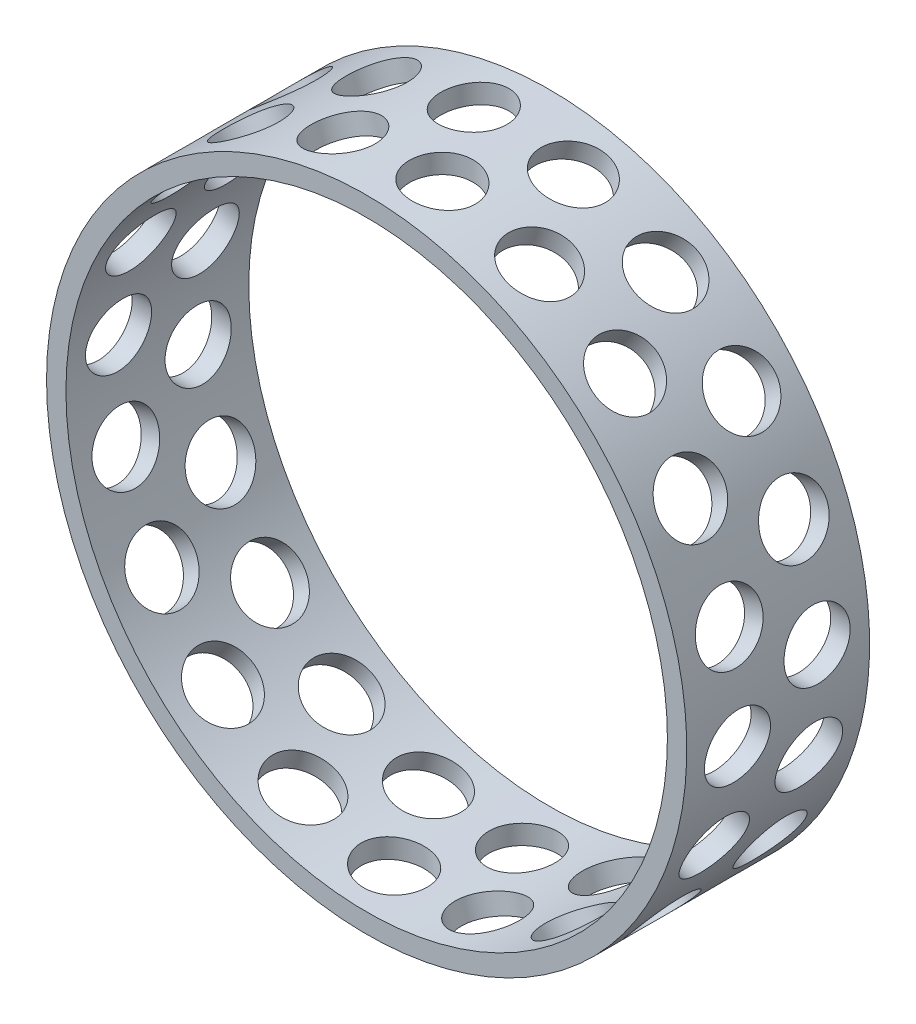
from build123d import *

# Parameters (mm, degrees)
SKETCH1_W          = 47.15
SKETCH1_H          = 5
SKETCH2_R          = 8.5
CUT_EXTRUDE1_DEPTH = 127.283124367
CIRPATTERN1_COUNT  = 20


with BuildPart() as part:
    # Sketch1 → Revolve1 (revolve)
    with BuildSketch(Plane(origin=(0, 0, 0), x_dir=(0, 0, -1), z_dir=(1, 0, 0))):
        with Locations((24.575, 80.05)):
            Rectangle(SKETCH1_W, SKETCH1_H)
    revolve(axis=Axis((0, 0, -50.5075), (0, 0, 1)))

    # Sketch2 → Cut-Extrude1 (cut, through all)
    with BuildSketch(Plane(origin=(0, 0, 0), x_dir=(0, 0, -1), z_dir=(1, 0, 0))):
        with Locations((14.309765987, 6.214899086)):
            Circle(SKETCH2_R)
        with Locations((34.840234013, -6.214899086)):
            Circle(SKETCH2_R)
    cut_extrude1 = extrude(amount=-CUT_EXTRUDE1_DEPTH, mode=Mode.SUBTRACT)

    # CirPattern1: Cut-Extrude1 ×20 about axis
    cirpattern1_axis = Axis((0, 0, -50.5075), (0, 0, 1))
    for i in range(1, CIRPATTERN1_COUNT):
        add(cut_extrude1.rotate(cirpattern1_axis, i * 360 / CIRPATTERN1_COUNT), mode=Mode.SUBTRACT)


solid = part.part
